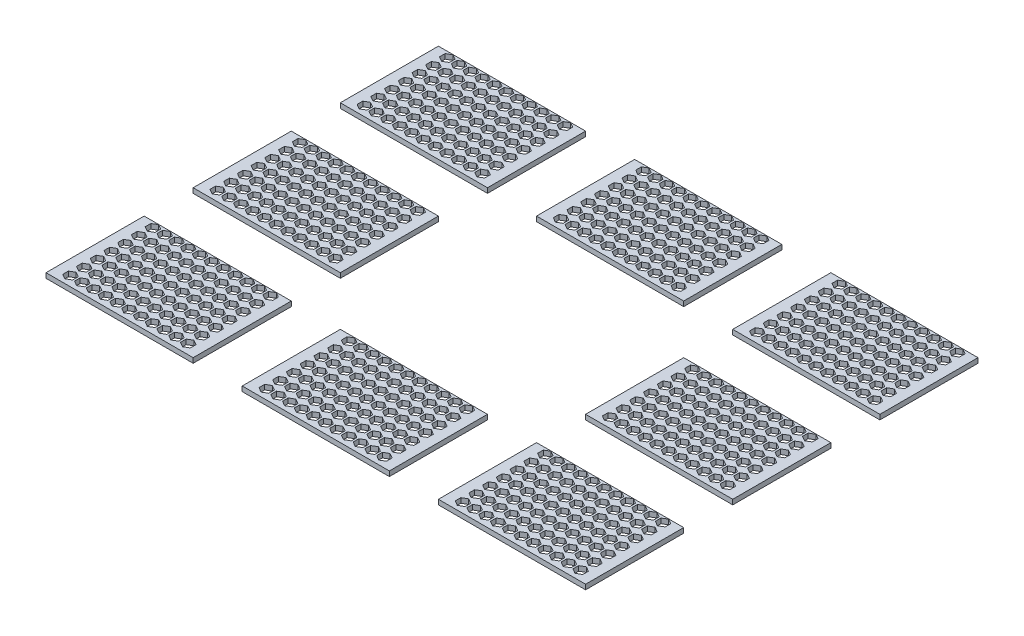
from build123d import *

# Parameters (mm, degrees)
SKETCH1_W            = 381
SKETCH1_H            = 254
BOSS_EXTRUDE1_DEPTH  = 12.7
CUT_EXTRUDE1_DEPTH   = 459.081095441
LPATTERN1_COUNT      = 11
LPATTERN1_PITCH      = 30.48
LPATTERN1_COUNT_DIR2 = 7
LPATTERN1_PITCH_DIR2 = 35.56


with BuildPart() as part:
    # Sketch1 → Boss-Extrude1 (new body)
    with BuildSketch(Plane(origin=(0, 0, 0), x_dir=(1, 0, 0), z_dir=(0, 1, 0))):
        with Locations((190.5, 127)):
            Rectangle(SKETCH1_W, SKETCH1_H)
    extrude(amount=BOSS_EXTRUDE1_DEPTH)

    # Sketch2 → Cut-Extrude1 (cut, through all)
    with BuildSketch(Plane(origin=(0, 12.7, 0), x_dir=(1, 0, 0), z_dir=(0, 1, 0))):
        Polygon((38.1, 10.735303163), (50.8, 18.067651581), (50.8, 32.732348419), (38.1, 40.064696837), (25.4, 32.732348419), (25.4, 18.067651581), align=None)
    cut_extrude1 = extrude(amount=-CUT_EXTRUDE1_DEPTH, mode=Mode.SUBTRACT)

    # LPattern1: Cut-Extrude1 11 × 7
    with Locations(*[(i * LPATTERN1_PITCH, 0, -j * LPATTERN1_PITCH_DIR2) for i in range(LPATTERN1_COUNT) for j in range(LPATTERN1_COUNT_DIR2) if (i, j) != (0, 0)]):
        add(cut_extrude1, mode=Mode.SUBTRACT)


with BuildPart() as body_2:
    # LPattern2: read off the stored shape, not the designer's step
    # LPattern2: copy of part
    add(part.part.moved(Location((1016, 0, 762))))


with BuildPart() as body_3:
    # LPattern2 2: copy of part
    add(part.part.moved(Location((508, 0, 762))))


with BuildPart() as body_4:
    # LPattern2 3: copy of part
    add(part.part.moved(Location((0, 0, 762))))


with BuildPart() as body_5:
    # LPattern2 4: copy of part
    add(part.part.moved(Location((1016, 0, 381))))


with BuildPart() as body_6:
    # LPattern2 5: copy of part
    add(part.part.moved(Location((0, 0, 381))))


with BuildPart() as body_7:
    # LPattern2 6: copy of part
    add(part.part.moved(Location((1016, 0, 0))))


with BuildPart() as body_8:
    # LPattern2 7: copy of part
    add(part.part.moved(Location((508, 0, 0))))


solid = Compound([part.part, body_2.part, body_3.part, body_4.part, body_5.part, body_6.part, body_7.part, body_8.part])
